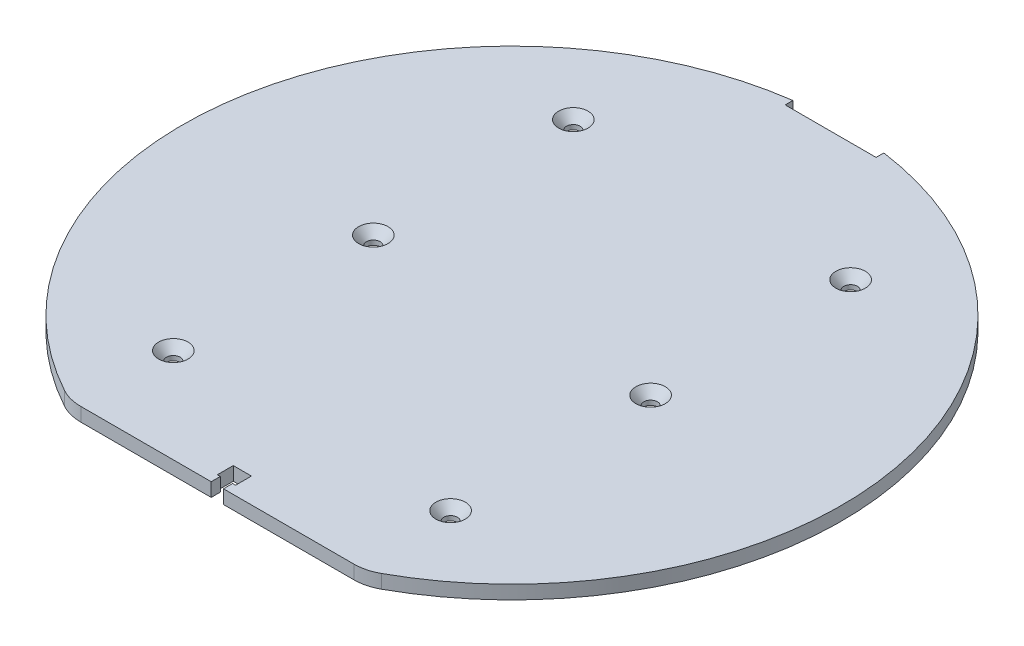
from build123d import *
from OCP.BRepFilletAPI import BRepFilletAPI_MakeChamfer

# Parameters (mm, degrees)
BOSS_EXTRUDE1_DEPTH = 3
SKETCH2_R           = 1.5
CUT_EXTRUDE1_DEPTH  = 103.574363269
CHAMFER1_SIZE       = 2
CHAMFER1_SIZE2      = 1.738573476
CUT_EXTRUDE2_DEPTH  = 103.574363269
SKETCH4_W           = 20
SKETCH4_H           = 1.7
CUT_EXTRUDE3_DEPTH  = 103.574363269


with BuildPart() as part:
    # Sketch1 → Boss-Extrude1 (new body)
    with BuildSketch(Plane(origin=(0, 0, 0), x_dir=(1, 0, 0), z_dir=(0, 1, 0))):
        with BuildLine():
            Line((30.029977361, -64.812867647), (-30.029977361, -64.812867647))
            ThreePointArc((-30.029977361, -64.812867647), (-32.509837414, -64.500503794), (-34.834773739, -63.582926471))
            ThreePointArc((-34.834773739, -63.582926471), (0, 72.5), (34.834773739, -63.582926471))
            ThreePointArc((34.834773739, -63.582926471), (32.509837414, -64.500503794), (30.029977361, -64.812867647))
        make_face()
    extrude(amount=BOSS_EXTRUDE1_DEPTH)

    # Sketch2 → Cut-Extrude1 (cut, through all)
    with BuildSketch(Plane(origin=(0, 3, 0), x_dir=(1, 0, 0), z_dir=(0, 1, 0))):
        with Locations((-30.5, 44)):
            Circle(SKETCH2_R)
        with Locations((30.5, 44)):
            Circle(SKETCH2_R)
        with Locations((30.5, 0)):
            Circle(SKETCH2_R)
        with Locations((30.5, -44)):
            Circle(SKETCH2_R)
        with Locations((-30.5, -44)):
            Circle(SKETCH2_R)
        with Locations((-30.5, 0)):
            Circle(SKETCH2_R)
    extrude(amount=-CUT_EXTRUDE1_DEPTH, mode=Mode.SUBTRACT)

    # Chamfer1: one chamfer whose edges measure the first distance from different faces: ONE call of the kernel's chamfer builder (chamfer() names one face for all edges)
    chamfer1_edges_1 = [part.edges().sort_by_distance(p)[0] for p in [
        (29, 3, -44),
    ]]
    chamfer1_side_1 = [part.faces().sort_by_distance(p)[0] for p in [
        (29, 1.5, -44),
    ]]
    chamfer1_edges_2 = [part.edges().sort_by_distance(p)[0] for p in [
        (29, 3, 0),
    ]]
    chamfer1_side_2 = [part.faces().sort_by_distance(p)[0] for p in [
        (29, 1.5, 0),
    ]]
    chamfer1_edges_3 = [part.edges().sort_by_distance(p)[0] for p in [
        (29, 3, 44),
    ]]
    chamfer1_side_3 = [part.faces().sort_by_distance(p)[0] for p in [
        (29, 1.5, 44),
    ]]
    chamfer1_edges_4 = [part.edges().sort_by_distance(p)[0] for p in [
        (-32, 3, 44),
    ]]
    chamfer1_side_4 = [part.faces().sort_by_distance(p)[0] for p in [
        (-32, 1.5, 44),
    ]]
    chamfer1_edges_5 = [part.edges().sort_by_distance(p)[0] for p in [
        (-32, 3, 0),
    ]]
    chamfer1_side_5 = [part.faces().sort_by_distance(p)[0] for p in [
        (-32, 1.5, 0),
    ]]
    chamfer1_edges_6 = [part.edges().sort_by_distance(p)[0] for p in [
        (-32, 3, -44),
    ]]
    chamfer1_side_6 = [part.faces().sort_by_distance(p)[0] for p in [
        (-32, 1.5, -44),
    ]]
    chamfer1 = BRepFilletAPI_MakeChamfer(part.part.solid().wrapped)
    for e in chamfer1_edges_1:
        chamfer1.Add(CHAMFER1_SIZE, CHAMFER1_SIZE2, e.wrapped, chamfer1_side_1[0].wrapped)  # the first distance lies on this face
    for e in chamfer1_edges_2:
        chamfer1.Add(CHAMFER1_SIZE, CHAMFER1_SIZE2, e.wrapped, chamfer1_side_2[0].wrapped)  # the first distance lies on this face
    for e in chamfer1_edges_3:
        chamfer1.Add(CHAMFER1_SIZE, CHAMFER1_SIZE2, e.wrapped, chamfer1_side_3[0].wrapped)  # the first distance lies on this face
    for e in chamfer1_edges_4:
        chamfer1.Add(CHAMFER1_SIZE, CHAMFER1_SIZE2, e.wrapped, chamfer1_side_4[0].wrapped)  # the first distance lies on this face
    for e in chamfer1_edges_5:
        chamfer1.Add(CHAMFER1_SIZE, CHAMFER1_SIZE2, e.wrapped, chamfer1_side_5[0].wrapped)  # the first distance lies on this face
    for e in chamfer1_edges_6:
        chamfer1.Add(CHAMFER1_SIZE, CHAMFER1_SIZE2, e.wrapped, chamfer1_side_6[0].wrapped)  # the first distance lies on this face
    add(Compound.cast(chamfer1.Shape()), mode=Mode.REPLACE)

    # Sketch3 → Cut-Extrude2 (cut, through all)
    with BuildSketch(Plane(origin=(0, 3, 0), x_dir=(1, 0, 0), z_dir=(0, 1, 0))):
        Polygon((1.35, -62.812867647), (2, -62.812867647), (2, -59.312867647), (-2, -59.312867647), (-2, -62.812867647), (-1.35, -62.812867647), (-1.35, -64.812867647), (1.35, -64.812867647), align=None)
    extrude(amount=-CUT_EXTRUDE2_DEPTH, mode=Mode.SUBTRACT)

    # Sketch4 → Cut-Extrude3 (cut, through all)
    with BuildSketch(Plane(origin=(0, 3, 0), x_dir=(1, 0, 0), z_dir=(0, 1, 0))):
        with Locations((0, 70.957033082)):
            Rectangle(SKETCH4_W, SKETCH4_H)
    extrude(amount=-CUT_EXTRUDE3_DEPTH, mode=Mode.SUBTRACT)


with BuildPart() as body_2:
    # of the pieces the cut leaves, the one that is kept (cut_extrude3_keep)
    add(part.part.solids().sort_by_distance((-30.029977361, 3, 64.812867647))[0])


solid = body_2.part
